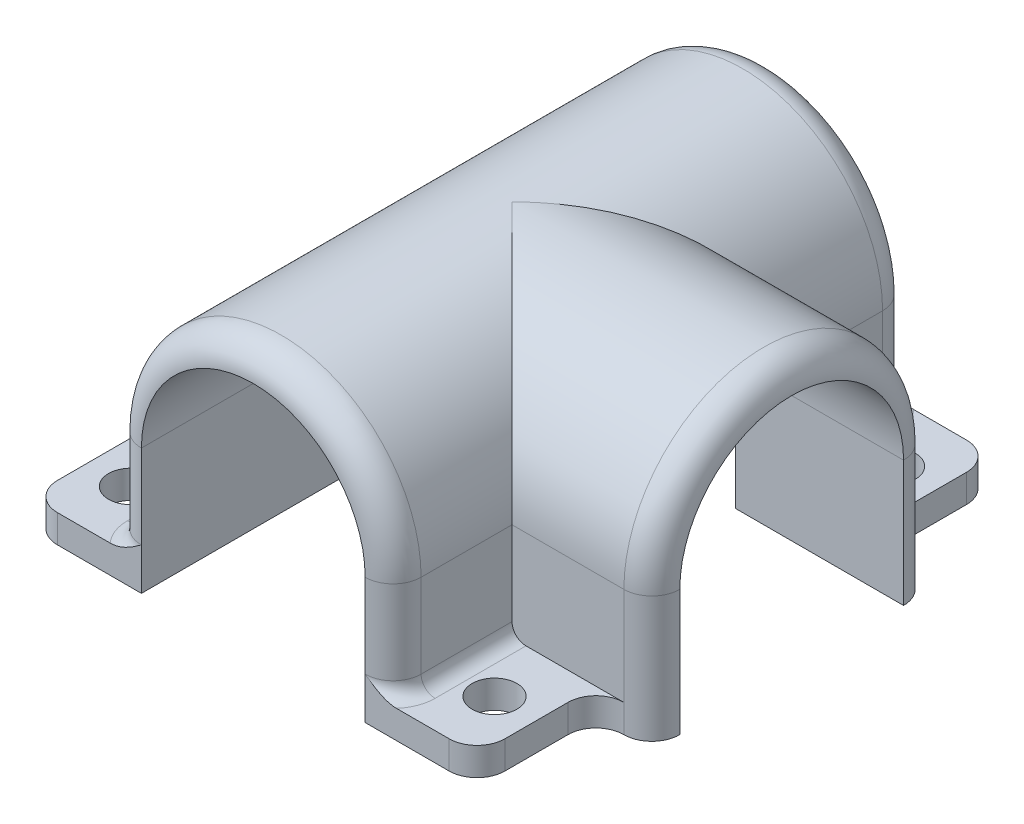
from build123d import *

# Parameters (mm, degrees)
BOSS_EXTRUDE2_DEPTH  = 18.5
M3_CLEARANCE_HOLE1_D = 3.2
BOSS_EXTRUDE3_REACH  = 43.692
CUT_EXTRUDE1_REACH   = 43.692
FILLET1_R            = 2
FILLET2_R            = 1


# Some blends are built 0.0001 mm under size
with BuildPart() as part:
    # Sketch2 → Boss-Extrude2 (new, symmetric)
    with BuildSketch(Plane.XY):
        with BuildLine():
            Line((-8, 0), (-8, -9))
            Line((-8, -9), (-16, -9))
            Line((-16, -9), (-16, -7))
            Line((-16, -7), (-10, -7))
            Line((-10, -7), (-10, 0))
            ThreePointArc((-10, 0), (0, 10), (10, 0))
            Line((10, 0), (10, -7))
            Line((10, -7), (16, -7))
            Line((16, -7), (16, -9))
            Line((16, -9), (8, -9))
            Line((8, -9), (8, 0))
            ThreePointArc((8, 0), (0, 8), (-8, 0))
        make_face()
    extrude(amount=BOSS_EXTRUDE2_DEPTH, both=True)

    # M3 Clearance Hole1 (through all)
    with Locations(Plane(origin=(0, -7, 0), x_dir=(1, 0, 0), z_dir=(0, 1, 0))):
        with Locations((-13, 14.25), (13, 14.25), (13, -14.25), (-13, -14.25)):
            Hole(M3_CLEARANCE_HOLE1_D / 2)

    # Sketch6 → Boss-Extrude3 (add, up to next)
    with BuildSketch(Plane(origin=(20, 0, 0), x_dir=(0, 0, -1), z_dir=(1, 0, 0)), mode=Mode.PRIVATE) as boss_extrude3_sk1:
        with BuildLine():
            Line((-8, 0), (-8, -9))
            Line((-8, -9), (-10, -9))
            Line((-10, -9), (-10, 0))
            ThreePointArc((-10, 0), (0, 10), (10, 0))
            Line((10, 0), (10, -9))
            Line((10, -9), (8, -9))
            Line((8, -9), (8, 0))
            ThreePointArc((8, 0), (0, 8), (-8, 0))
        make_face()
    boss_extrude3_tool1 = extrude(boss_extrude3_sk1.sketch, amount=-BOSS_EXTRUDE3_REACH, mode=Mode.PRIVATE) - part.part
    add(boss_extrude3_tool1.solids().sort_by_distance((20, -4.5, -9.724138))[0])

    # Sketch7 → Cut-Extrude1 (cut, up to next)
    with BuildSketch(Plane(origin=(20, 0, 0), x_dir=(0, 0, -1), z_dir=(1, 0, 0)), mode=Mode.PRIVATE) as cut_extrude1_sk1:
        with BuildLine():
            Line((8, 0), (8, -7))
            Line((8, -7), (8, -9))
            Line((8, -9), (-8, -9))
            Line((-8, -9), (-8, -7))
            Line((-8, -7), (-8, 0))
            ThreePointArc((-8, 0), (0, 8), (8, 0))
        make_face()
    cut_extrude1_tool1 = extrude(cut_extrude1_sk1.sketch, amount=-CUT_EXTRUDE1_REACH, mode=Mode.PRIVATE) & part.part
    add(cut_extrude1_tool1.solids().sort_by_distance((20, -1.254102, 0))[0], mode=Mode.SUBTRACT)

    # Fillet1
    fillet1_edges = [part.edges().sort_by_distance(p)[0] for p in [
        (16, -8, -10),
        (16, -8, 10),
        (16, -8, 18.5),
        (16, -8, -18.5),
        (-16, -8, 18.5),
        (-16, -8, -18.5),
        (20, -4.5, 10),
        (20, 10, 0),
        (20, -4.5, -10),
        (10, -3.5, -18.5),
        (-10, -3.5, -18.5),
        (10, -3.5, 18.5),
        (-10, -3.5, 18.5),
        (0, 10, -18.5),
        (0, 10, 18.5),
    ]]
    fillet(fillet1_edges, radius=FILLET1_R - 0.0001)  # a hair under: the kernel refuses the full size

    # Fillet2
    # the kernel refuses this fillet: 1 mm, written as the material it adds along each edge
    with BuildSketch(Plane(origin=(-10, -7, 16.5001), x_dir=(0, 1, 0), z_dir=(0, 0, -1))) as fillet2_piece_1:
        with BuildLine():
            CenterArc((FILLET2_R, -FILLET2_R), FILLET2_R, 90, 90)
            Line((0, -FILLET2_R), (0, 0))
            Line((0, 0), (FILLET2_R, 0))
        make_face()
    extrude(amount=33.0002)
    with BuildSketch(Plane(origin=(10, -7, 16.5001), x_dir=(0, 1, 0), z_dir=(0, 0, -1)), Plane(origin=(10, -7, -10), x_dir=(0, 1, 0), z_dir=(0, 0, -1))) as fillet2_piece_2:
        with BuildLine():
            CenterArc((FILLET2_R, FILLET2_R), FILLET2_R, 180, 90)
            Line((0, FILLET2_R), (0, 0))
            Line((0, 0), (FILLET2_R, 0))
        make_face()
    extrude(amount=6.5001)
    with BuildSketch(Plane(origin=(8.0001, -7, -16.5001), x_dir=(1, 0, 0), z_dir=(0, 0, 1))) as fillet2_piece_3_section:
        with BuildLine():
            CenterArc((1.9999 + FILLET2_R, FILLET2_R), FILLET2_R, 180, 90)
            Line((1.9999, FILLET2_R), (1.9999, 0))
            Line((1.9999, 0), (1.9999 + FILLET2_R, 0))
        make_face()
    fillet2_piece_3 = revolve(axis=Axis((8.0001, -7, -16.5001), (0, 1, 0)), revolution_arc=161.652077223, mode=Mode.PRIVATE)
    fillet2_piece_3 = split(fillet2_piece_3, bisect_by=Plane(origin=(10.2121031, -6.837361474, -18.5), z_dir=(0, 0, 1)), keep=Keep.TOP, mode=Mode.PRIVATE)
    fillet2_piece_3 = split(fillet2_piece_3, bisect_by=Plane(origin=(8, -6.837361474, -17.073760291), z_dir=(1, 0, 0)), keep=Keep.TOP, mode=Mode.PRIVATE)
    add(fillet2_piece_3)
    with BuildSketch(Plane(origin=(-8.0001, -7, -16.5001), x_dir=(-1, 0, 0), z_dir=(0, 0, 1))) as fillet2_piece_4_section:
        with BuildLine():
            CenterArc((1.9999 + FILLET2_R, -FILLET2_R), FILLET2_R, 90, 90)
            Line((1.9999 + FILLET2_R, 0), (1.9999, 0))
            Line((1.9999, 0), (1.9999, -FILLET2_R))
        make_face()
    fillet2_piece_4 = revolve(axis=Axis((-8.0001, -7, -16.5001), (0, -1, 0)), revolution_arc=161.652077223, mode=Mode.PRIVATE)
    fillet2_piece_4 = split(fillet2_piece_4, bisect_by=Plane(origin=(-8, -6.727847021, -17.962226861), z_dir=(-1, 0, 0)), keep=Keep.TOP, mode=Mode.PRIVATE)
    fillet2_piece_4 = split(fillet2_piece_4, bisect_by=Plane(origin=(-9.462226887, -6.727847021, -18.5), z_dir=(0, 0, 1)), keep=Keep.TOP, mode=Mode.PRIVATE)
    add(fillet2_piece_4)
    with BuildSketch(Plane(origin=(8.0001, -7, 16.5001), x_dir=(-0.949162519062451, 0, 0.3147864552470806), z_dir=(-0.3147864552470806, 0, -0.949162519062451))) as fillet2_piece_5_section:
        with BuildLine():
            CenterArc((1.9999 + FILLET2_R, FILLET2_R), FILLET2_R, 180, 90)
            Line((1.9999, FILLET2_R), (1.9999, 0))
            Line((1.9999, 0), (1.9999 + FILLET2_R, 0))
        make_face()
    fillet2_piece_5 = revolve(axis=Axis((8.0001, -7, 16.5001), (0, 1, 0)), revolution_arc=161.652077223, mode=Mode.PRIVATE)
    fillet2_piece_5 = split(fillet2_piece_5, bisect_by=Plane(origin=(9.462226477, -6.727846247, 18.5), z_dir=(0, 0, -1)), keep=Keep.TOP, mode=Mode.PRIVATE)
    fillet2_piece_5 = split(fillet2_piece_5, bisect_by=Plane(origin=(8, -6.727846247, 17.962227025), z_dir=(1, 0, 0)), keep=Keep.TOP, mode=Mode.PRIVATE)
    add(fillet2_piece_5)
    with BuildSketch(Plane(origin=(-8.0001, -7, 16.5001), x_dir=(0.949162519062451, 0, 0.3147864552470806), z_dir=(0.3147864552470806, 0, -0.949162519062451))) as fillet2_piece_6_section:
        with BuildLine():
            CenterArc((1.9999 + FILLET2_R, -FILLET2_R), FILLET2_R, 90, 90)
            Line((1.9999 + FILLET2_R, 0), (1.9999, 0))
            Line((1.9999, 0), (1.9999, -FILLET2_R))
        make_face()
    fillet2_piece_6 = revolve(axis=Axis((-8.0001, -7, 16.5001), (0, -1, 0)), revolution_arc=161.652077223, mode=Mode.PRIVATE)
    fillet2_piece_6 = split(fillet2_piece_6, bisect_by=Plane(origin=(-9.462226765, -6.727846718, 18.5), z_dir=(0, 0, -1)), keep=Keep.TOP, mode=Mode.PRIVATE)
    fillet2_piece_6 = split(fillet2_piece_6, bisect_by=Plane(origin=(-8, -6.727846718, 17.962226739), z_dir=(-1, 0, 0)), keep=Keep.TOP, mode=Mode.PRIVATE)
    add(fillet2_piece_6)


solid = part.part
